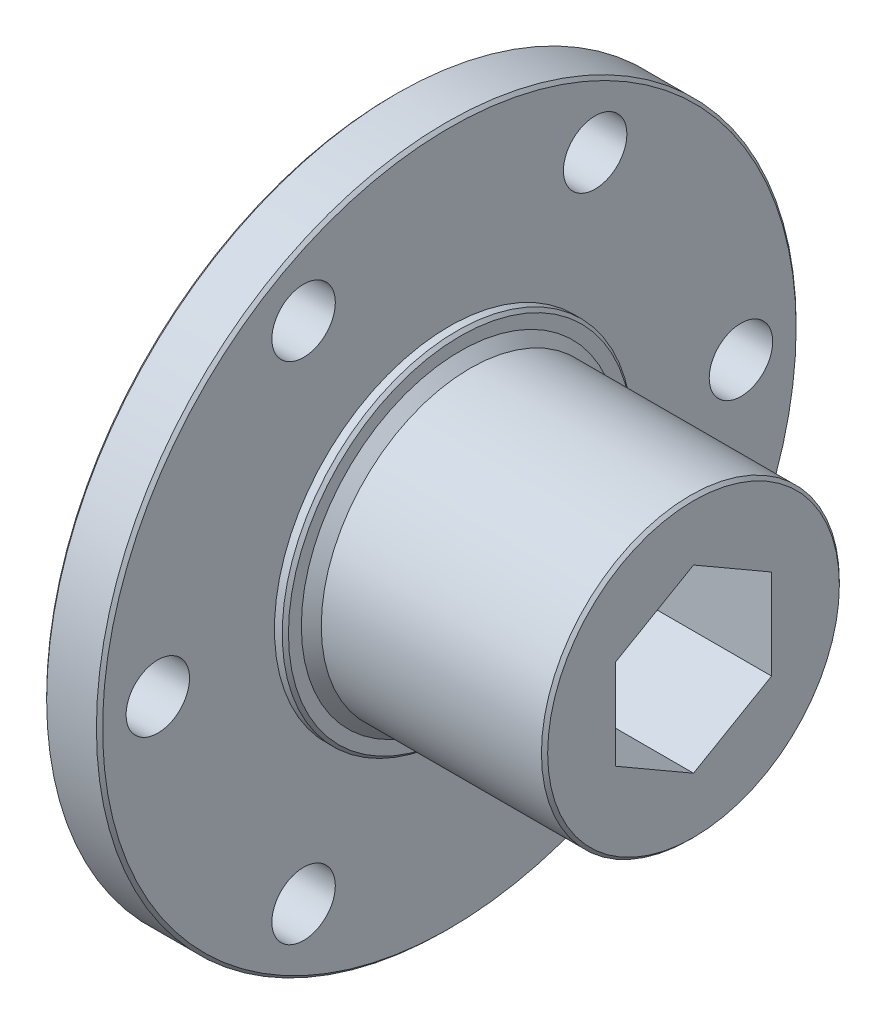
from build123d import *

# Parameters (mm, degrees)
SKETCH1_W                      = 4.572
SKETCH1_H                      = 28.575
SKETCH2_R                      = 14.2875
BOSS_EXTRUDE1_DEPTH            = 0.889
SKETCH3_R                      = 12.9794
BOSS_EXTRUDE2_DEPTH            = 0.8128
BOSS_EXTRUDE2_TAPER            = 45
SKETCH4_R                      = 12.1666
BOSS_EXTRUDE3_DEPTH            = 18.2372
BOSS_EXTRUDE4_START            = 0.889
SKETCH5_R                      = 14.2875
BOSS_EXTRUDE4_DEPTH            = 0.889
CUT_EXTRUDE1_DEPTH             = 48.730716001
F_6_0_204_DIAMETER_HOLE1_D     = 5.1816
F_6_0_204_DIAMETER_HOLE1_DEPTH = 24.511
CHAMFER1_SIZE                  = 0.254


with BuildPart() as part:
    # Sketch1 → Revolve1 (revolve)
    with BuildSketch(Plane(origin=(0, 0, 0), x_dir=(-1, 0, 0), z_dir=(0, 0, -1))):
        with Locations((16.210066246, 14.2875)):
            Rectangle(SKETCH1_W, SKETCH1_H)
    revolve(axis=Axis((-13.924066246, 0, 0), (-1, 0, 0)))

    # Sketch2 → Boss-Extrude1 (add)
    with BuildSketch(Plane(origin=(-13.924066246, 0, 0), x_dir=(0, 0, -1), z_dir=(1, 0, 0))):
        Circle(SKETCH2_R)
    extrude(amount=BOSS_EXTRUDE1_DEPTH)

    # Sketch3 → Boss-Extrude2 (add)
    with BuildSketch(Plane(origin=(-13.035066246, 0, 0), x_dir=(0, 0, -1), z_dir=(1, 0, 0))):
        Circle(SKETCH3_R)
    extrude(amount=BOSS_EXTRUDE2_DEPTH, taper=BOSS_EXTRUDE2_TAPER)

    # Sketch4 → Boss-Extrude3 (add)
    with BuildSketch(Plane(origin=(-12.222266246, 0, 0), x_dir=(0, 0, -1), z_dir=(1, 0, 0))):
        Circle(SKETCH4_R)
    extrude(amount=BOSS_EXTRUDE3_DEPTH)

    # Sketch5 → Boss-Extrude4 (add)
    with BuildSketch(Plane.ZY.offset(18.496066246).offset(BOSS_EXTRUDE4_START)):
        Circle(SKETCH5_R)
    extrude(amount=-BOSS_EXTRUDE4_DEPTH)

    # Sketch6 → Cut-Extrude1 (cut, through all)
    with BuildSketch(Plane.ZY.offset(19.385066246)):
        Polygon((0, 7.361657812), (-6.3754, 3.680818906), (-6.3754, -3.680858906), (0, -7.361697812), (6.3754, -3.680858906), (6.3754, 3.680818906), align=None)
    extrude(amount=-CUT_EXTRUDE1_DEPTH, mode=Mode.SUBTRACT)

    # #6 (0.204) Diameter Hole1
    with Locations(Plane.ZY.offset(18.496066246)):
        with Locations((11.90625, 20.622229928), (-23.8125, 0), (11.90625, -20.622229928), (-11.90625, -20.622229928), (-11.90625, 20.622229928), (23.8125, 0)):
            Hole(F_6_0_204_DIAMETER_HOLE1_D / 2, depth=F_6_0_204_DIAMETER_HOLE1_DEPTH)

    # Chamfer1
    chamfer1_edges = [part.edges().sort_by_distance(p)[0] for p in [
        (-19.385066246, 0, -14.2875),
        (6.014933754, 0, 12.1666),
        (-18.496066246, -28.575, 0),
        (-13.035066246, 0, 14.2875),
        (-13.924066246, -28.575, 0),
    ]]
    chamfer(chamfer1_edges, length=CHAMFER1_SIZE)


solid = part.part
